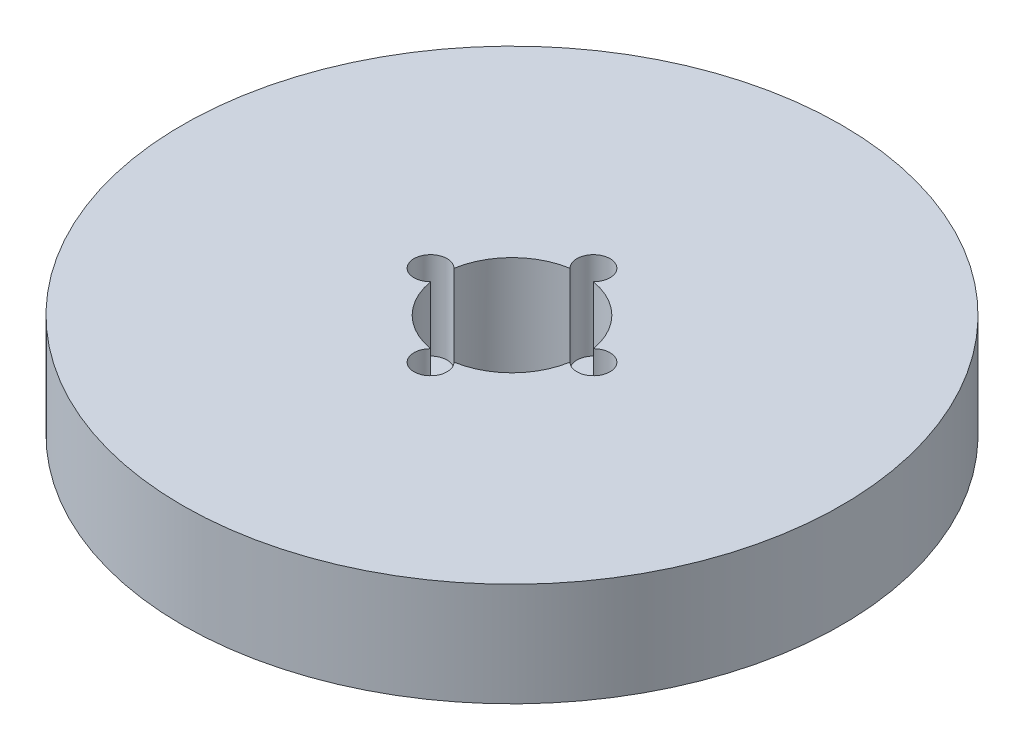
from build123d import *

# Parameters (mm, degrees)
SKETCH1_R           = 35
BOSS_EXTRUDE1_DEPTH = 11
SKETCH2_R           = 7.5
CUT_EXTRUDE1_DEPTH  = 51.705029336
SKETCH3_R           = 1.760082553
CUT_EXTRUDE2_DEPTH  = 9.330998048
CIRPATTERN1_COUNT   = 4


with BuildPart() as part:
    # Sketch1 → Boss-Extrude1 (new body)
    with BuildSketch(Plane(origin=(0, 0, 0), x_dir=(1, 0, 0), z_dir=(0, 1, 0))):
        Circle(SKETCH1_R)
    extrude(amount=BOSS_EXTRUDE1_DEPTH)

    # Sketch2 → Cut-Extrude1 (cut, through all)
    with BuildSketch(Plane(origin=(0, 0, 0), x_dir=(1, 0, 0), z_dir=(0, 1, 0))):
        Circle(SKETCH2_R)
    extrude(amount=CUT_EXTRUDE1_DEPTH, mode=Mode.SUBTRACT)

    # Sketch3 → Cut-Extrude2 (cut)
    with BuildSketch(Plane(origin=(0, 11, 0), x_dir=(1, 0, 0), z_dir=(0, 1, 0))):
        with Locations((-8.651150233, 0)):
            Circle(SKETCH3_R)
    cut_extrude2 = extrude(amount=-CUT_EXTRUDE2_DEPTH, mode=Mode.SUBTRACT)

    # CirPattern1: Cut-Extrude2 ×4 about axis
    cirpattern1_axis = Axis((0, 0, 0), (0, 1, 0))
    for i in range(1, CIRPATTERN1_COUNT):
        add(cut_extrude2.rotate(cirpattern1_axis, i * 360 / CIRPATTERN1_COUNT), mode=Mode.SUBTRACT)


solid = part.part
